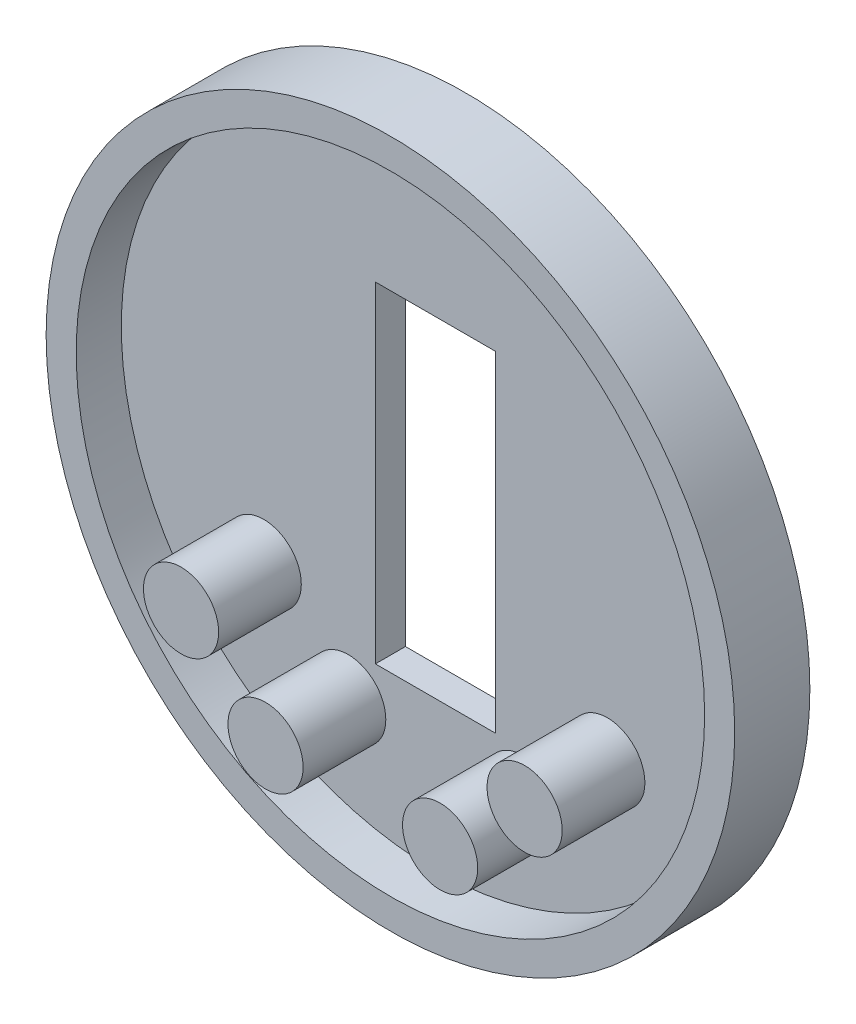
from build123d import *

# Parameters (mm, degrees)
SCHNITT_LINEAR_AUSTRAGEN1_DEPTH = 10
SKIZZE3_R                       = 2.5
AUFSATZ_LINEAR_AUSTRAGEN1_DEPTH = 7.5
SKIZZE3_5_R                     = 2.5
AUFSATZ_LINEAR_AUSTRAGEN2_DEPTH = 7.5
SKIZZE3_6_R                     = 2.5
AUFSATZ_LINEAR_AUSTRAGEN3_DEPTH = 7.5
SKIZZE3_7_R                     = 2.5
AUFSATZ_LINEAR_AUSTRAGEN4_DEPTH = 7.5


with BuildPart() as part:
    # Skizze1 → Rotation2 (revolve)
    with BuildSketch(Plane(origin=(0, 0, 0), x_dir=(1, 0, 0), z_dir=(0, 1, 0))):
        Polygon((0, 0), (22.902, 0), (22.902, -5), (20.902, -5), (20.902, -2), (0, -2), align=None)
    revolve(axis=Axis((0, 0, 2), (0, 0, -1)))

    # Skizze2 → Schnitt-Linear austragen1 (cut)
    with BuildSketch(Plane(origin=(0, 0, 0), x_dir=(-1, 0, 0), z_dir=(0, 0, -1))):
        Polygon((4, 0), (4, 11), (-4, 11), (-4, -11), (4, -11), align=None)
    extrude(amount=-SCHNITT_LINEAR_AUSTRAGEN1_DEPTH, mode=Mode.SUBTRACT)

    # Skizze3 → Aufsatz-Linear austragen1 (add)
    with BuildSketch(Plane.XY):
        with Locations((11.4275, -8.885)):
            Circle(SKIZZE3_R)
    extrude(amount=AUFSATZ_LINEAR_AUSTRAGEN1_DEPTH)

    # Skizze3<5> → Aufsatz-Linear austragen2 (add)
    with BuildSketch(Plane.XY):
        with Locations((5.8065, -13.863)):
            Circle(SKIZZE3_5_R)
    extrude(amount=AUFSATZ_LINEAR_AUSTRAGEN2_DEPTH)

    # Skizze3<6> → Aufsatz-Linear austragen3 (add)
    with BuildSketch(Plane.XY):
        with Locations((-5.8065, -13.863)):
            Circle(SKIZZE3_6_R)
    extrude(amount=AUFSATZ_LINEAR_AUSTRAGEN3_DEPTH)

    # Skizze3<7> → Aufsatz-Linear austragen4 (add)
    with BuildSketch(Plane.XY):
        with Locations((-11.4275, -8.885)):
            Circle(SKIZZE3_7_R)
    extrude(amount=AUFSATZ_LINEAR_AUSTRAGEN4_DEPTH)


solid = part.part
